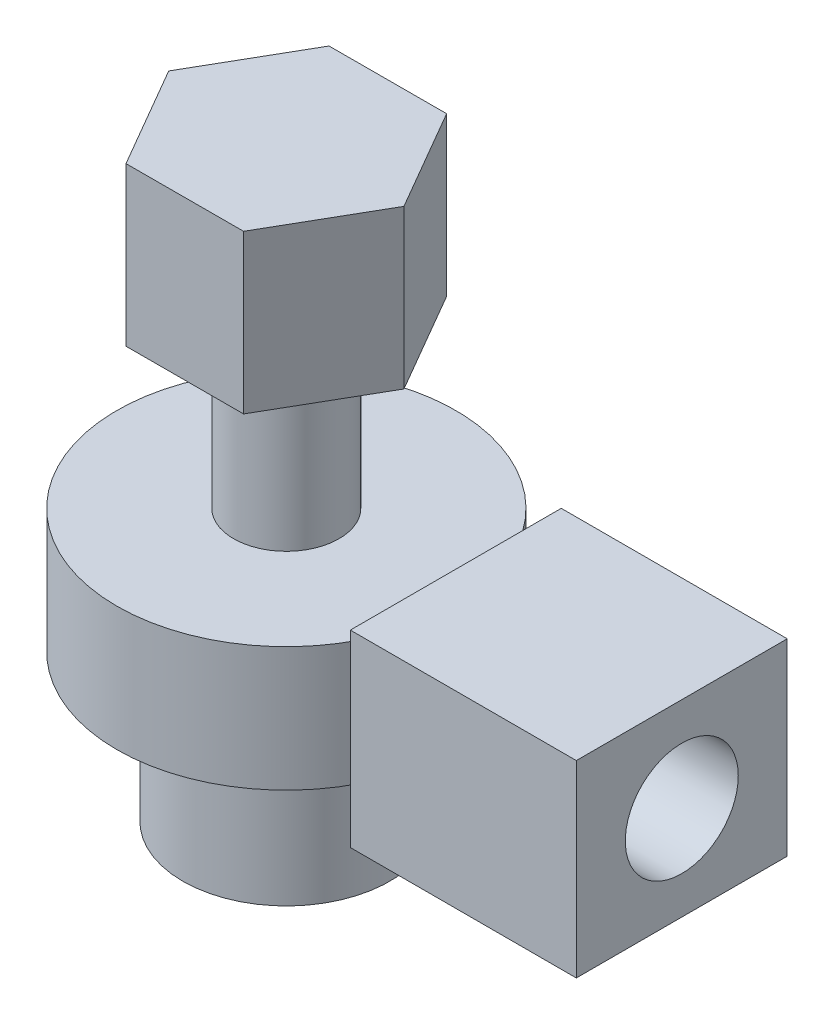
from build123d import *

# Parameters (mm, degrees)
SKETCH1_R           = 2.75
BOSS_EXTRUDE1_DEPTH = 3.2
SKETCH2_R           = 1.4
BOSS_EXTRUDE2_DEPTH = 8.3
BOSS_EXTRUDE3_DEPTH = 4.2
SKETCH6_R           = 4.5
BOSS_EXTRUDE5_DEPTH = 3.3
SKETCH7_W           = 5.6
SKETCH7_H           = 5
BOSS_EXTRUDE6_DEPTH = 6
SKETCH8_R           = 1.5
CUT_EXTRUDE1_DEPTH  = 5


with BuildPart() as part:
    # Sketch1 → Boss-Extrude1 (new body)
    with BuildSketch(Plane(origin=(0, 0, 0), x_dir=(1, 0, 0), z_dir=(0, 1, 0))):
        Circle(SKETCH1_R)
    extrude(amount=BOSS_EXTRUDE1_DEPTH)

    # Sketch2 → Boss-Extrude2 (add)
    with BuildSketch(Plane(origin=(0, 3.2, 0), x_dir=(1, 0, 0), z_dir=(0, 1, 0))):
        Circle(SKETCH2_R)
    extrude(amount=BOSS_EXTRUDE2_DEPTH)

    # Sketch3 → Boss-Extrude3 (add)
    with BuildSketch(Plane(origin=(0, 11.5, 0), x_dir=(1, 0, 0), z_dir=(0, 1, 0))):
        Polygon((1.554649618, 2.702418281), (-1.563038074, 2.697575204), (-3.117687692, -0.004843077), (-1.554649618, -2.702418281), (1.563038074, -2.697575204), (3.117687692, 0.004843077), align=None)
    extrude(amount=BOSS_EXTRUDE3_DEPTH)

    # Sketch6 → Boss-Extrude5 (add)
    with BuildSketch(Plane(origin=(0, 3.9, 0), x_dir=(1, 0, 0), z_dir=(0, 1, 0))):
        Circle(SKETCH6_R)
    extrude(amount=BOSS_EXTRUDE5_DEPTH)


with BuildPart() as body_2:
    # Sketch7 → Boss-Extrude6 (new body)
    with BuildSketch(Plane(origin=(4.5, 0, 0), x_dir=(0, 0, -1), z_dir=(1, 0, 0))):
        with Locations((0, 5.55)):
            Rectangle(SKETCH7_W, SKETCH7_H)
    extrude(amount=BOSS_EXTRUDE6_DEPTH)

    # Sketch8 → Cut-Extrude1 (cut)
    with BuildSketch(Plane(origin=(10.5, 0, 0), x_dir=(0, 0, -1), z_dir=(1, 0, 0))):
        with Locations((0, 5.55)):
            Circle(SKETCH8_R)
    extrude(amount=-CUT_EXTRUDE1_DEPTH, mode=Mode.SUBTRACT)


solid = Compound([part.part, body_2.part])
